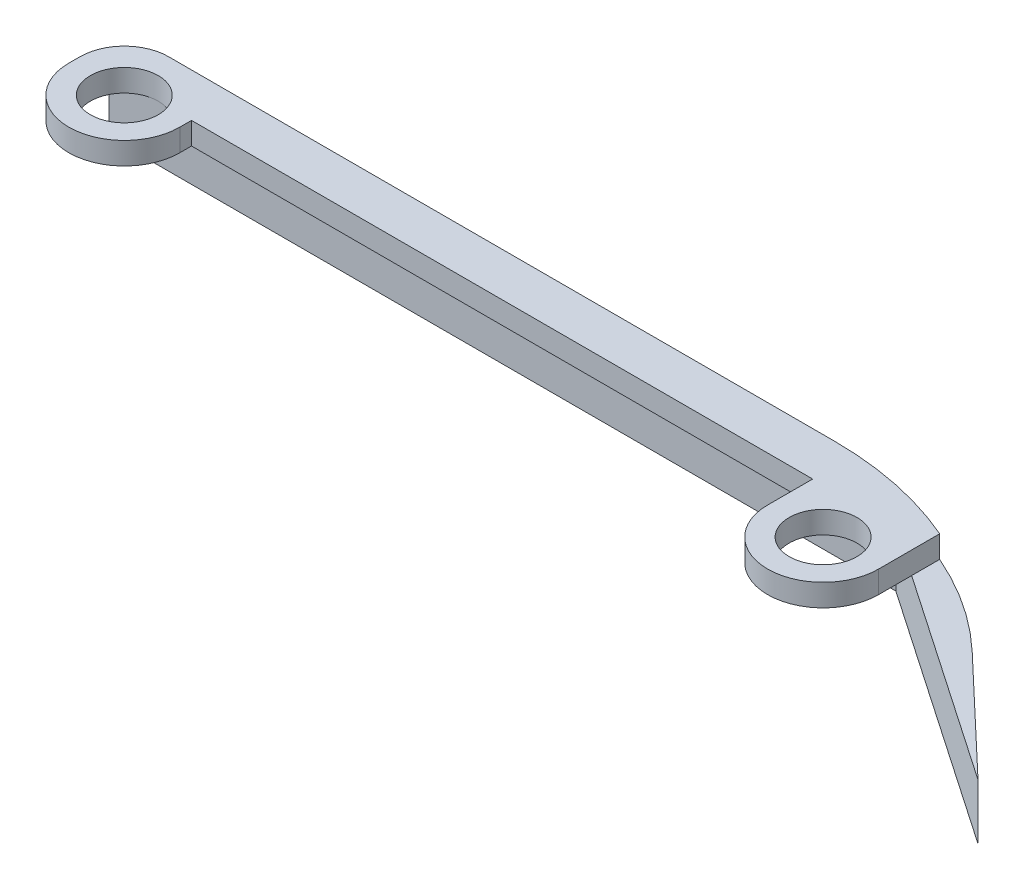
from build123d import *

# Parameters (mm, degrees)
SKETCH1_R           = 3.06
BOSS_EXTRUDE1_DEPTH = 2
BOSS_EXTRUDE3_DEPTH = 5
SKETCH6_W           = 56
SKETCH6_H           = 2
BOSS_EXTRUDE4_DEPTH = 2
FILLET2_R           = 30
FILLET3_R           = 4


with BuildPart() as part:
    # Sketch1 → Boss-Extrude1 (new body)
    with BuildSketch(Plane(origin=(0, 0, 0), x_dir=(1, 0, 0), z_dir=(0, 1, 0))):
        with BuildLine():
            Line((-5, 0), (-5, 5))
            Line((-5, 5), (71, 5))
            Line((71, 5), (71, -3))
            ThreePointArc((71, -3), (66, -8), (61, -3))
            Line((61, -3), (61, 3.06))
            Line((61, 3.06), (5, 3.06))
            Line((5, 3.06), (5, 0))
            ThreePointArc((5, 0), (0, -5), (-5, 0))
        make_face()
        with Locations(Location((0, 0, 0), (0, 0, 270))):
            Circle(SKETCH1_R, mode=Mode.SUBTRACT)
        with Locations(Location((66, -3, 0), (0, 0, 270))):
            Circle(SKETCH1_R, mode=Mode.SUBTRACT)
    extrude(amount=BOSS_EXTRUDE1_DEPTH)

    # Sketch4 → Boss-Extrude3 (add)
    with BuildSketch(Plane(origin=(0, 0, 0), x_dir=(-1, 0, 0), z_dir=(0, -1, 0))):
        Polygon((5, 5), (-71, 5), (-89.933264969, -12.968832246), (-66.5, 3.06), (5, 3.06), align=None)
    extrude(amount=BOSS_EXTRUDE3_DEPTH)

    # Sketch6 → Boss-Extrude4 (add)
    with BuildSketch(Plane(origin=(0, 2, 0), x_dir=(1, 0, 0), z_dir=(0, 1, 0))):
        with Locations((33, 2.06)):
            Rectangle(SKETCH6_W, SKETCH6_H)
    extrude(amount=-BOSS_EXTRUDE4_DEPTH)

    # Fillet2
    # the kernel refuses this fillet: 30 mm, written as the material it takes off along each edge
    with BuildSketch(Plane(origin=(71, 29.924182181, -5), x_dir=(0.7253392750671382, 0, 0.6883915572151349), z_dir=(0, -1, 0))) as fillet2_piece_1:
        with BuildLine():
            CenterArc((FILLET2_R * 0.398989095747, FILLET2_R), FILLET2_R, 226.497078838, 43.502921162)
            Line((-FILLET2_R * 0.289402461469, FILLET2_R * 0.274660724933), (0, 0))
            Line((0, 0), (FILLET2_R * 0.398989095747, 0))
        make_face()
    extrude(amount=64.848364362, mode=Mode.SUBTRACT)

    # Fillet3
    # the kernel refuses this fillet: 4 mm, written as the material it takes off along each edge
    with BuildSketch(Plane(origin=(-5, 12, -5), x_dir=(0, 0, 1), z_dir=(0, -1, 0))) as fillet3_piece_1:
        with BuildLine():
            CenterArc((FILLET3_R, -FILLET3_R), FILLET3_R, 90, 90)
            Line((0, -FILLET3_R), (0, 0))
            Line((0, 0), (FILLET3_R, 0))
        make_face()
    extrude(amount=27, mode=Mode.SUBTRACT)


solid = part.part
